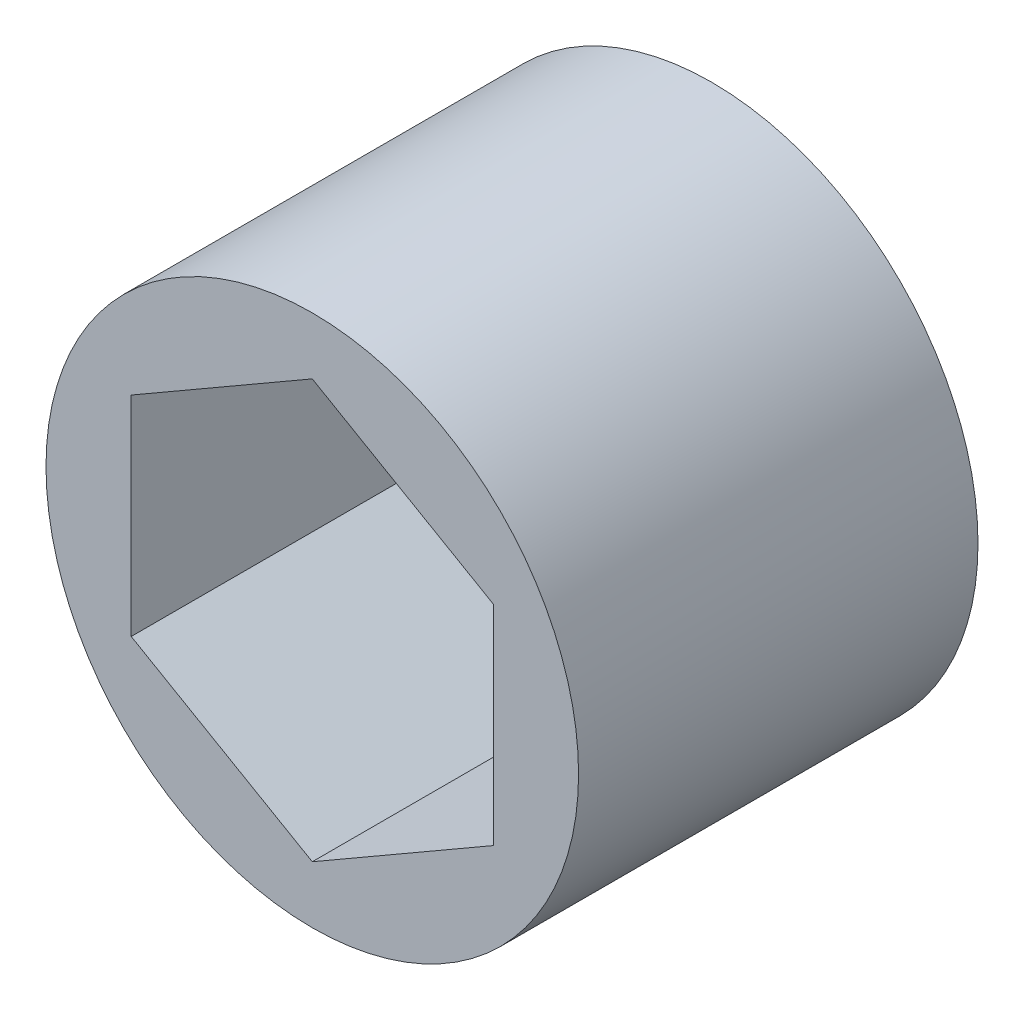
from build123d import *

# Parameters (mm, degrees)
SKETCH1_R           = 9.525
BOSS_EXTRUDE1_DEPTH = 7.14375


with BuildPart() as part:
    # Sketch1 → Boss-Extrude1 (new, symmetric)
    with BuildSketch(Plane.XY):
        Circle(SKETCH1_R)
        Polygon((0, 7.478995387), (-6.477, 3.739497694), (-6.477, -3.739497694), (0, -7.478995387), (6.477, -3.739497694), (6.477, 3.739497694), align=None, mode=Mode.SUBTRACT)
    extrude(amount=BOSS_EXTRUDE1_DEPTH, both=True)


solid = part.part
